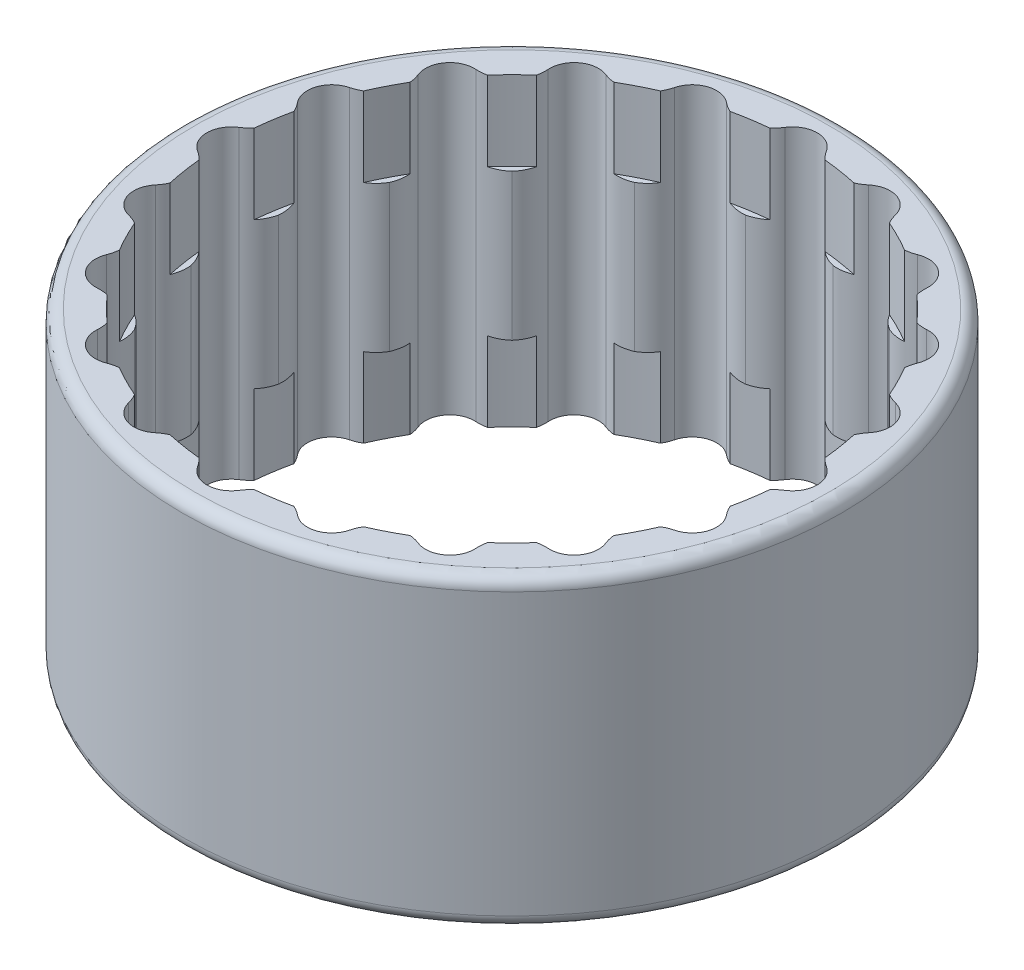
from build123d import *

# Parameters (mm, degrees)
SKETCH1_R               = 27
BOSS_EXTRUDE1_DEPTH     = 25
SKETCH3_R               = 23.5
CUT_EXTRUDE1_DEPTH      = 6.5
CUT_EXTRUDE2_START      = -6.5
SKETCH4_R               = 23.5
CUT_EXTRUDE2_DEPTH      = 6.5
SKETCH5_R               = 23
CUT_EXTRUDE4_DEPTH      = 43.429353047
CUT_EXTRUDE5_DEPTH      = 43.429353047
CUT_EXTRUDE5_DEPTH_BACK = 43.429353047
SKETCH6_R               = 2
FILLET1_START           = -1
FILLET1_DEPTH           = 27
FILLET2_R               = 1


with BuildPart() as part:
    # Sketch1 → Boss-Extrude1 (new body)
    with BuildSketch(Plane(origin=(0, 0, 0), x_dir=(1, 0, 0), z_dir=(0, 1, 0))):
        with Locations(Location((0, 0, 0), (0, 0, 270))):
            Circle(SKETCH1_R)
    extrude(amount=BOSS_EXTRUDE1_DEPTH)

    # Sketch3 → Cut-Extrude1 (cut)
    with BuildSketch(Plane(origin=(0, 25, 0), x_dir=(1, 0, 0), z_dir=(0, 1, 0))):
        with Locations(Location((0, 0, 0), (0, 0, 270))):
            Circle(SKETCH3_R)
    extrude(amount=-CUT_EXTRUDE1_DEPTH, mode=Mode.SUBTRACT)

    # Sketch4 → Cut-Extrude2 (cut)
    with BuildSketch(Plane.XZ.offset(CUT_EXTRUDE2_START)):
        with Locations(Location((0, 0, 0), (0, 0, 90))):
            Circle(SKETCH4_R)
    extrude(amount=CUT_EXTRUDE2_DEPTH, mode=Mode.SUBTRACT)

    # Sketch5 → Cut-Extrude4 (cut, through all)
    with BuildSketch(Plane(origin=(0, 18.5, 0), x_dir=(1, 0, 0), z_dir=(0, 1, 0))):
        with Locations(Location((0, 0, 0), (0, 0, 270))):
            Circle(SKETCH5_R)
    extrude(amount=-CUT_EXTRUDE4_DEPTH, mode=Mode.SUBTRACT)

    # Sketch6 → Cut-Extrude5 (cut, two sides: drawn at the far end of the back side and taken through both)
    with BuildSketch(Plane(origin=(0, 18.5, 0), x_dir=(1, 0, 0), z_dir=(0, 1, 0)).offset(-CUT_EXTRUDE5_DEPTH_BACK)):
        with Locations((0, 23)):
            Circle(SKETCH6_R)
        with Locations((7.107390871, 21.874299875)):
            Circle(SKETCH6_R)
        with Locations((13.519060803, 18.607390871)):
            Circle(SKETCH6_R)
        with Locations((18.607390871, 13.519060803)):
            Circle(SKETCH6_R)
        with Locations((21.874299875, 7.107390871)):
            Circle(SKETCH6_R)
        with Locations((23, 0)):
            Circle(SKETCH6_R)
        with Locations((21.874299875, -7.107390871)):
            Circle(SKETCH6_R)
        with Locations((18.607390871, -13.519060803)):
            Circle(SKETCH6_R)
        with Locations((13.519060803, -18.607390871)):
            Circle(SKETCH6_R)
        with Locations((7.107390871, -21.874299875)):
            Circle(SKETCH6_R)
        with Locations((0, -23)):
            Circle(SKETCH6_R)
        with Locations((-7.107390871, -21.874299875)):
            Circle(SKETCH6_R)
        with Locations((-13.519060803, -18.607390871)):
            Circle(SKETCH6_R)
        with Locations((-18.607390871, -13.519060803)):
            Circle(SKETCH6_R)
        with Locations((-21.874299875, -7.107390871)):
            Circle(SKETCH6_R)
        with Locations((-23, 0)):
            Circle(SKETCH6_R)
        with Locations((-21.874299875, 7.107390871)):
            Circle(SKETCH6_R)
        with Locations((-18.607390871, 13.519060803)):
            Circle(SKETCH6_R)
        with Locations((-13.519060803, 18.607390871)):
            Circle(SKETCH6_R)
        with Locations((-7.107390871, 21.874299875)):
            Circle(SKETCH6_R)
    extrude(amount=CUT_EXTRUDE5_DEPTH + CUT_EXTRUDE5_DEPTH_BACK, mode=Mode.SUBTRACT)

    # Fillet1: read off the stored shape, not the designer's step
    # Fillet1 outline → Fillet1 (cut)
    with BuildSketch(Plane(origin=(0, 0, 0), x_dir=(1, 0, 0), z_dir=(0, 1, 0)).offset(FILLET1_START)):
        with BuildLine():
            ThreePointArc((22.359323463, 9.047687786), (21.287310522, 9.557794468), (20.497110962, 10.443799676))
            ThreePointArc((20.497110962, 10.443799676), (20.244785339, 11.603865344), (20.462213761, 12.770975217))
            ThreePointArc((20.462213761, 12.770975217), (20.156650114, 12.254230459), (19.711500421, 11.851445109))
            ThreePointArc((19.711500421, 11.851445109), (20.493150056, 10.441781494), (21.174149749, 8.980834171))
            ThreePointArc((21.174149749, 8.980834171), (21.761662367, 9.104216549), (22.359323463, 9.047687786))
        make_face()
        with BuildLine():
            ThreePointArc((17.362582713, 15.084452974), (17.883213165, 15.383347972), (18.469090994, 15.514273358))
            ThreePointArc((18.469090994, 15.514273358), (17.291914467, 15.668143426), (16.266599359, 16.266599359))
            ThreePointArc((16.266599359, 16.266599359), (15.668143426, 17.291914467), (15.514273359, 18.469090994))
            ThreePointArc((15.514273359, 18.469090994), (15.383347972, 17.883213165), (15.084452974, 17.362582713))
            ThreePointArc((15.084452974, 17.362582713), (16.263455967, 16.263455967), (17.362582713, 15.084452974))
        make_face()
        with BuildLine():
            ThreePointArc((22.721222531, 3.598688114), (22.839726609, 4.779949032), (23.407170112, 5.822747404))
            ThreePointArc((23.407170112, 5.822747404), (22.956878901, 5.425718295), (22.409048867, 5.180205484))
            ThreePointArc((22.409048867, 5.180205484), (22.716831834, 3.597992696), (22.913043478, 1.998108747))
            ThreePointArc((22.913043478, 1.998108747), (23.509928433, 1.933900978), (24.060869565, 1.695451493))
            ThreePointArc((24.060869565, 1.695451493), (23.198956305, 2.511861994), (22.721222531, 3.598688114))
        make_face()
        with BuildLine():
            ThreePointArc((11.851445109, 19.711500421), (12.254230459, 20.156650114), (12.770975217, 20.462213761))
            ThreePointArc((12.770975217, 20.462213761), (11.603865344, 20.244785339), (10.443799676, 20.497110962))
            ThreePointArc((10.443799676, 20.497110962), (9.557794468, 21.287310522), (9.047687786, 22.359323463))
            ThreePointArc((9.047687786, 22.359323463), (9.104216549, 21.761662367), (8.980834171, 21.174149749))
            ThreePointArc((8.980834171, 21.174149749), (10.441781494, 20.493150056), (11.851445109, 19.711500421))
        make_face()
        with BuildLine():
            ThreePointArc((22.721222531, -3.598688114), (23.198956305, -2.511861994), (24.060869565, -1.695451493))
            ThreePointArc((24.060869565, -1.695451493), (23.509928433, -1.933900978), (22.913043478, -1.998108747))
            ThreePointArc((22.913043478, -1.998108747), (22.716831834, -3.597992696), (22.409048867, -5.180205484))
            ThreePointArc((22.409048867, -5.180205484), (22.956878901, -5.425718295), (23.407170112, -5.822747404))
            ThreePointArc((23.407170112, -5.822747404), (22.839726609, -4.779949032), (22.721222531, -3.598688114))
        make_face()
        with BuildLine():
            ThreePointArc((5.180205484, 22.409048867), (5.425718295, 22.956878901), (5.822747404, 23.407170112))
            ThreePointArc((5.822747404, 23.407170112), (4.779949032, 22.839726609), (3.598688114, 22.721222531))
            ThreePointArc((3.598688114, 22.721222531), (2.511861994, 23.198956305), (1.695451493, 24.060869565))
            ThreePointArc((1.695451493, 24.060869565), (1.933900978, 23.509928433), (1.998108747, 22.913043478))
            ThreePointArc((1.998108747, 22.913043478), (3.597992696, 22.716831834), (5.180205484, 22.409048867))
        make_face()
        with BuildLine():
            ThreePointArc((20.497110962, -10.443799676), (21.287310522, -9.557794468), (22.359323463, -9.047687786))
            ThreePointArc((22.359323463, -9.047687786), (21.761662367, -9.104216549), (21.174149749, -8.980834171))
            ThreePointArc((21.174149749, -8.980834171), (20.493150056, -10.441781494), (19.711500421, -11.851445109))
            ThreePointArc((19.711500421, -11.851445109), (20.156650114, -12.254230459), (20.462213761, -12.770975217))
            ThreePointArc((20.462213761, -12.770975217), (20.244785339, -11.603865344), (20.497110962, -10.443799676))
        make_face()
        with BuildLine():
            ThreePointArc((-1.998108747, 22.913043478), (-1.933900978, 23.509928433), (-1.695451493, 24.060869565))
            ThreePointArc((-1.695451493, 24.060869565), (-2.511861994, 23.198956305), (-3.598688114, 22.721222531))
            ThreePointArc((-3.598688114, 22.721222531), (-4.779949032, 22.839726609), (-5.822747404, 23.407170112))
            ThreePointArc((-5.822747404, 23.407170112), (-5.425718295, 22.956878901), (-5.180205484, 22.409048867))
            ThreePointArc((-5.180205484, 22.409048867), (-3.597992696, 22.716831834), (-1.998108747, 22.913043478))
        make_face()
        with BuildLine():
            ThreePointArc((16.266599359, -16.266599359), (17.291914467, -15.668143426), (18.469090994, -15.514273359))
            ThreePointArc((18.469090994, -15.514273359), (17.883213165, -15.383347972), (17.362582713, -15.084452974))
            ThreePointArc((17.362582713, -15.084452974), (16.263455967, -16.263455967), (15.084452974, -17.362582713))
            ThreePointArc((15.084452974, -17.362582713), (15.383347972, -17.883213165), (15.514273358, -18.469090994))
            ThreePointArc((15.514273358, -18.469090994), (15.668143426, -17.291914467), (16.266599359, -16.266599359))
        make_face()
        with BuildLine():
            ThreePointArc((-8.980834171, 21.174149749), (-9.104216549, 21.761662367), (-9.047687785, 22.359323463))
            ThreePointArc((-9.047687785, 22.359323463), (-9.557794468, 21.287310522), (-10.443799676, 20.497110962))
            ThreePointArc((-10.443799676, 20.497110962), (-11.603865344, 20.244785339), (-12.770975217, 20.462213761))
            ThreePointArc((-12.770975217, 20.462213761), (-12.254230459, 20.156650114), (-11.851445109, 19.711500421))
            ThreePointArc((-11.851445109, 19.711500421), (-10.441781494, 20.493150056), (-8.980834171, 21.174149749))
        make_face()
        with BuildLine():
            ThreePointArc((10.443799676, -20.497110962), (11.603865344, -20.244785339), (12.770975217, -20.462213761))
            ThreePointArc((12.770975217, -20.462213761), (12.254230459, -20.156650114), (11.851445109, -19.711500421))
            ThreePointArc((11.851445109, -19.711500421), (10.441781494, -20.493150056), (8.980834171, -21.174149749))
            ThreePointArc((8.980834171, -21.174149749), (9.104216549, -21.761662367), (9.047687785, -22.359323463))
            ThreePointArc((9.047687785, -22.359323463), (9.557794468, -21.287310522), (10.443799676, -20.497110962))
        make_face()
        with BuildLine():
            ThreePointArc((-15.084452974, 17.362582713), (-15.383347972, 17.883213165), (-15.514273358, 18.469090994))
            ThreePointArc((-15.514273358, 18.469090994), (-15.668143426, 17.291914467), (-16.266599359, 16.266599359))
            ThreePointArc((-16.266599359, 16.266599359), (-17.291914467, 15.668143426), (-18.469090994, 15.514273359))
            ThreePointArc((-18.469090994, 15.514273359), (-17.883213165, 15.383347972), (-17.362582713, 15.084452974))
            ThreePointArc((-17.362582713, 15.084452974), (-16.263455967, 16.263455967), (-15.084452974, 17.362582713))
        make_face()
        with BuildLine():
            ThreePointArc((3.598688114, -22.721222531), (4.779949032, -22.839726609), (5.822747404, -23.407170112))
            ThreePointArc((5.822747404, -23.407170112), (5.425718295, -22.956878901), (5.180205484, -22.409048867))
            ThreePointArc((5.180205484, -22.409048867), (3.597992696, -22.716831834), (1.998108747, -22.913043478))
            ThreePointArc((1.998108747, -22.913043478), (1.933900978, -23.509928433), (1.695451493, -24.060869565))
            ThreePointArc((1.695451493, -24.060869565), (2.511861994, -23.198956305), (3.598688114, -22.721222531))
        make_face()
        with BuildLine():
            ThreePointArc((-19.711500421, 11.851445109), (-20.156650114, 12.254230459), (-20.462213761, 12.770975217))
            ThreePointArc((-20.462213761, 12.770975217), (-20.244785339, 11.603865344), (-20.497110962, 10.443799676))
            ThreePointArc((-20.497110962, 10.443799676), (-21.287310522, 9.557794468), (-22.359323463, 9.047687786))
            ThreePointArc((-22.359323463, 9.047687786), (-21.761662367, 9.104216549), (-21.174149749, 8.980834171))
            ThreePointArc((-21.174149749, 8.980834171), (-20.493150056, 10.441781494), (-19.711500421, 11.851445109))
        make_face()
        with BuildLine():
            ThreePointArc((-3.598688114, -22.721222531), (-2.511861994, -23.198956305), (-1.695451493, -24.060869565))
            ThreePointArc((-1.695451493, -24.060869565), (-1.933900978, -23.509928433), (-1.998108747, -22.913043478))
            ThreePointArc((-1.998108747, -22.913043478), (-3.597992696, -22.716831834), (-5.180205484, -22.409048867))
            ThreePointArc((-5.180205484, -22.409048867), (-5.425718295, -22.956878901), (-5.822747404, -23.407170112))
            ThreePointArc((-5.822747404, -23.407170112), (-4.779949032, -22.839726609), (-3.598688114, -22.721222531))
        make_face()
        with BuildLine():
            ThreePointArc((-22.409048867, 5.180205484), (-22.956878901, 5.425718295), (-23.407170112, 5.822747404))
            ThreePointArc((-23.407170112, 5.822747404), (-22.839726609, 4.779949032), (-22.721222531, 3.598688114))
            ThreePointArc((-22.721222531, 3.598688114), (-23.198956305, 2.511861994), (-24.060869565, 1.695451493))
            ThreePointArc((-24.060869565, 1.695451493), (-23.509928433, 1.933900978), (-22.913043478, 1.998108747))
            ThreePointArc((-22.913043478, 1.998108747), (-22.716831834, 3.597992696), (-22.409048867, 5.180205484))
        make_face()
        with BuildLine():
            ThreePointArc((-10.443799676, -20.497110962), (-9.557794468, -21.287310522), (-9.047687786, -22.359323463))
            ThreePointArc((-9.047687786, -22.359323463), (-9.104216549, -21.761662367), (-8.980834171, -21.174149749))
            ThreePointArc((-8.980834171, -21.174149749), (-10.441781494, -20.493150056), (-11.851445109, -19.711500421))
            ThreePointArc((-11.851445109, -19.711500421), (-12.254230459, -20.156650114), (-12.770975217, -20.462213761))
            ThreePointArc((-12.770975217, -20.462213761), (-11.603865344, -20.244785339), (-10.443799676, -20.497110962))
        make_face()
        with BuildLine():
            ThreePointArc((-22.913043478, -1.998108747), (-23.509928433, -1.933900978), (-24.060869565, -1.695451493))
            ThreePointArc((-24.060869565, -1.695451493), (-23.198956305, -2.511861994), (-22.721222531, -3.598688114))
            ThreePointArc((-22.721222531, -3.598688114), (-22.839726609, -4.779949032), (-23.407170112, -5.822747404))
            ThreePointArc((-23.407170112, -5.822747404), (-22.956878901, -5.425718295), (-22.409048867, -5.180205484))
            ThreePointArc((-22.409048867, -5.180205484), (-22.716831834, -3.597992696), (-22.913043478, -1.998108747))
        make_face()
        with BuildLine():
            ThreePointArc((-16.266599359, -16.266599359), (-15.668143426, -17.291914467), (-15.514273359, -18.469090994))
            ThreePointArc((-15.514273359, -18.469090994), (-15.383347972, -17.883213165), (-15.084452974, -17.362582713))
            ThreePointArc((-15.084452974, -17.362582713), (-16.263455967, -16.263455967), (-17.362582713, -15.084452974))
            ThreePointArc((-17.362582713, -15.084452974), (-17.883213165, -15.383347972), (-18.469090994, -15.514273358))
            ThreePointArc((-18.469090994, -15.514273358), (-17.291914467, -15.668143426), (-16.266599359, -16.266599359))
        make_face()
        with BuildLine():
            ThreePointArc((-21.174149749, -8.980834171), (-21.761662367, -9.104216549), (-22.359323463, -9.047687785))
            ThreePointArc((-22.359323463, -9.047687785), (-21.287310522, -9.557794468), (-20.497110962, -10.443799676))
            ThreePointArc((-20.497110962, -10.443799676), (-20.244785339, -11.603865344), (-20.462213761, -12.770975217))
            ThreePointArc((-20.462213761, -12.770975217), (-20.156650114, -12.254230459), (-19.711500421, -11.851445109))
            ThreePointArc((-19.711500421, -11.851445109), (-20.493150056, -10.441781494), (-21.174149749, -8.980834171))
        make_face()
    extrude(amount=FILLET1_DEPTH, mode=Mode.SUBTRACT)

    # Fillet2
    fillet2_edges = [part.edges().sort_by_distance(p)[0] for p in [
        (0, 0, -27),
        (0, 25, -27),
    ]]
    fillet(fillet2_edges, radius=FILLET2_R)


solid = part.part
